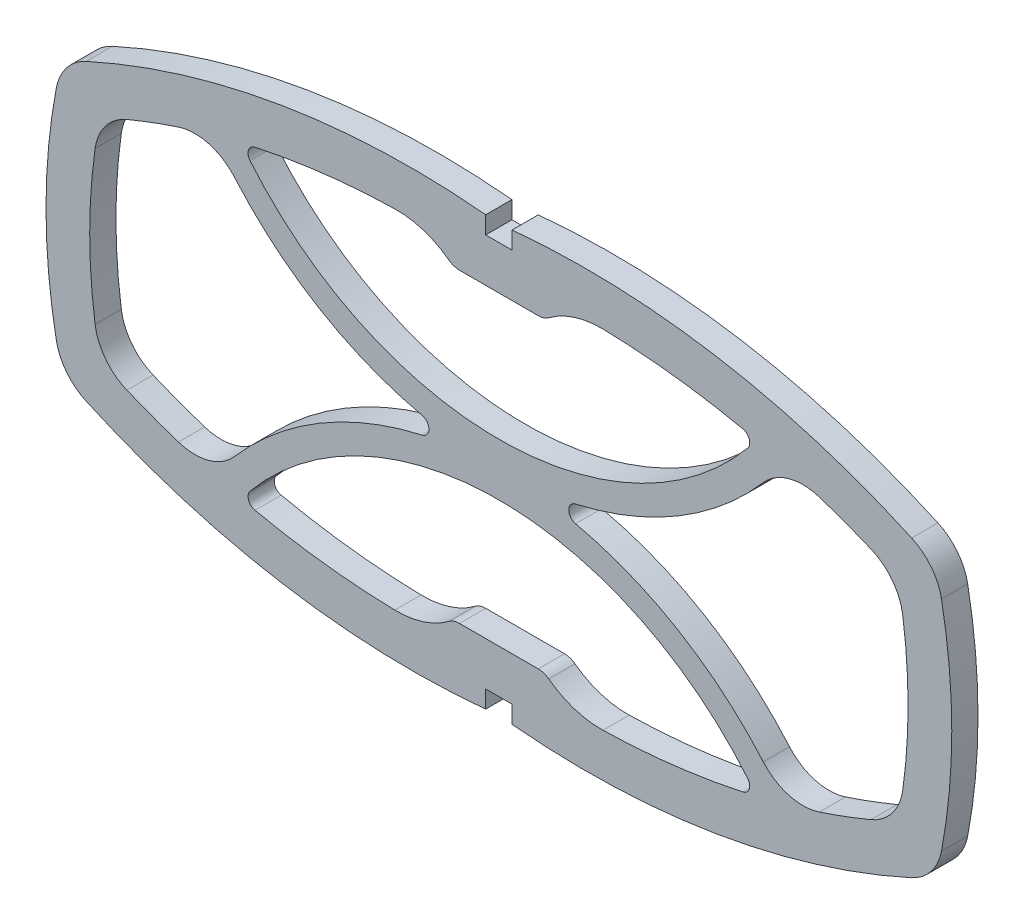
from build123d import *

# Parameters (mm, degrees)
BOSS_EXTRUDE1_DEPTH = 3
CUT_EXTRUDE1_REACH  = 69.03
SKETCH2_W           = 5
SKETCH2_H           = 35
BOSS_EXTRUDE8_DEPTH = 3
MIRROR1_DEPTH       = 3
FILLET1_R           = 2
FILLET2_R           = 10
FILLET3_R           = 6
FILLET4_R           = 1


# Read off the part's stored shape, not the designer's step: Mirror1
with BuildPart() as part:
    # Sketch1 → Boss-Extrude1 (new body)
    with BuildSketch(Plane.XY):
        with BuildLine():
            Line((-1.51, 0), (0, 0))
            Line((0, 0), (0, 5))
            Line((0, 5), (-1.51, 5))
            Line((-1.51, 5), (-1.51, 7))
            ThreePointArc((-1.51, 7), (-26.381774629, 5.897879108), (-50, -1.976082663))
            ThreePointArc((-50, -1.976082663), (-51.828078002, -17.5), (-50, -33.023917337))
            ThreePointArc((-50, -33.023917337), (-26.381774629, -40.897879108), (-1.51, -42))
            Line((-1.51, -42), (-1.51, -40))
            Line((-1.51, -40), (0, -40))
            Line((0, -40), (0, -35))
            Line((0, -35), (-1.51, -35))
            Line((-1.51, -35), (-1.51, -33))
            Line((-1.51, -33), (-1.51, -2))
            Line((-1.51, -2), (-1.51, 0))
        make_face()
    extrude(amount=BOSS_EXTRUDE1_DEPTH)

    # Sketch2 → Cut-Extrude1 (cut, up to next)
    with BuildSketch(Plane.XY.offset(3), mode=Mode.PRIVATE) as cut_extrude1_sk1:
        with BuildLine():
            ThreePointArc((-45.638636542, -5.430742036), (-46.828078002, -17.5), (-45.638636542, -29.569257964))
            ThreePointArc((-45.638636542, -29.569257964), (-26.536011476, -35.777357536), (-6.51, -37.329661985))
            Line((-6.51, -37.329661985), (-6.51, 2.329661985))
            ThreePointArc((-6.51, 2.329661985), (-26.536011476, 0.777357536), (-45.638636542, -5.430742036))
        make_face()
    cut_extrude1_tool1 = extrude(cut_extrude1_sk1.sketch, amount=-CUT_EXTRUDE1_REACH, mode=Mode.PRIVATE) & part.part
    # Sketch2 → Cut-Extrude1 (cut, up to next)
    with BuildSketch(Plane.XY.offset(3), mode=Mode.PRIVATE) as cut_extrude1_sk2:
        with Locations((-4.01, -17.5)):
            Rectangle(SKETCH2_W, SKETCH2_H)
    cut_extrude1_tool2 = extrude(cut_extrude1_sk2.sketch, amount=-CUT_EXTRUDE1_REACH, mode=Mode.PRIVATE) & part.part
    add(cut_extrude1_tool1.solids().sort_by_distance((-24.946194, -17.5, 3))[0], mode=Mode.SUBTRACT)
    add(cut_extrude1_tool2.solids().sort_by_distance((-4.01, -17.5, 3))[0], mode=Mode.SUBTRACT)

    # Sketch3 → Boss-Extrude8 (add)
    with BuildSketch(Plane.XY.offset(3)):
        with BuildLine():
            ThreePointArc((-32.612027687, -34.338487741), (-31.049231117, -34.753813219), (-29.478816537, -35.139334187))
            ThreePointArc((-29.478816537, -35.139334187), (-16.456843028, -24.361316901), (0, -20.5))
            Line((0, -20.5), (0, -14.5))
            ThreePointArc((0, -14.5), (-16.456843028, -10.638683099), (-29.478816537, 0.139334187))
            ThreePointArc((-29.478816537, 0.139334187), (-31.049231117, -0.246186781), (-32.612027687, -0.661512259))
            ThreePointArc((-32.612027687, -0.661512259), (-22.163998061, -10.798005795), (-8.780487851, -16.524390234))
            ThreePointArc((-8.780487851, -16.524390234), (-8, -17.499999784), (-8.780487429, -18.475609671))
            ThreePointArc((-8.780487429, -18.475609671), (-22.163997881, -24.201994085), (-32.612027687, -34.338487741))
        make_face()
    extrude(amount=-BOSS_EXTRUDE8_DEPTH)

    # Mirror1 outline → Mirror1 (add)
    with BuildSketch(Plane.XY):
        with BuildLine():
            ThreePointArc((29.478816537, -35.139334187), (18.069073524, -37.017473377), (6.51, -37.329661985))
            Line((6.51, -37.329661985), (6.51, -35))
            Line((6.51, -35), (0, -35))
            Line((0, -35), (0, -40))
            Line((0, -40), (1.51, -40))
            Line((1.51, -40), (1.51, -42))
            ThreePointArc((1.51, -42), (26.381774629, -40.897879108), (50, -33.023917337))
            ThreePointArc((50, -33.023917337), (51.828078002, -17.5), (50, -1.976082663))
            ThreePointArc((50, -1.976082663), (26.381774629, 5.897879108), (1.51, 7))
            Line((1.51, 7), (1.51, 5))
            Line((1.51, 5), (0, 5))
            Line((0, 5), (0, 0))
            Line((0, 0), (6.51, 0))
            Line((6.51, 0), (6.51, 2.329661985))
            ThreePointArc((6.51, 2.329661985), (18.069073524, 2.017473377), (29.478816537, 0.139334187))
            ThreePointArc((29.478816537, 0.139334187), (16.456843029, -10.638683099), (0, -14.5))
            Line((0, -14.5), (0, -20.5))
            ThreePointArc((0, -20.5), (16.456843029, -24.361316901), (29.478816537, -35.139334187))
        make_face()
        with BuildLine():
            ThreePointArc((45.638636542, -29.569257964), (39.22278835, -32.220063478), (32.612027687, -34.338487741))
            ThreePointArc((32.612027687, -34.338487741), (22.163998041, -24.201994192), (8.780487805, -18.475609756))
            ThreePointArc((8.780487805, -18.475609756), (8, -17.5), (8.780487805, -16.524390244))
            ThreePointArc((8.780487805, -16.524390244), (22.163998041, -10.798005808), (32.612027687, -0.661512259))
            ThreePointArc((32.612027687, -0.661512259), (39.22278835, -2.779936522), (45.638636542, -5.430742036))
            ThreePointArc((45.638636542, -5.430742036), (46.828078002, -17.5), (45.638636542, -29.569257964))
        make_face(mode=Mode.SUBTRACT)
    extrude(amount=MIRROR1_DEPTH)

    # Fillet1
    fillet1_edges = [part.edges().sort_by_distance(p)[0] for p in [
        (6.51, -35, 1.5),
        (6.51, 0, 1.5),
        (-6.51, 0, 1.5),
        (-6.51, -35, 1.5),
    ]]
    fillet(fillet1_edges, radius=FILLET1_R)

    # Fillet2
    fillet2_edges = [part.edges().sort_by_distance(p)[0] for p in [
        (-6.51, 2.329661985, 1.5),
        (6.51, 2.329661985, 1.5),
        (6.51, -37.329661985, 1.5),
        (-6.51, -37.329661985, 1.5),
    ]]
    fillet(fillet2_edges, radius=FILLET2_R)

    # Fillet3
    fillet3_edges = [part.edges().sort_by_distance(p)[0] for p in [
        (45.638636542, -5.430742036, 1.5),
        (45.638636542, -29.569257964, 1.5),
        (32.612027687, -0.661512259, 1.5),
        (32.612027687, -34.338487741, 1.5),
        (-50, -33.023917337, 1.5),
        (-50, -1.976082663, 1.5),
        (-45.638636542, -29.569257964, 1.5),
        (-45.638636542, -5.430742036, 1.5),
        (-32.612027687, -0.661512259, 1.5),
        (-32.612027687, -34.338487741, 1.5),
        (50, -1.976082663, 1.5),
        (50, -33.023917337, 1.5),
    ]]
    fillet(fillet3_edges, radius=FILLET3_R)

    # Fillet4
    fillet4_edges = [part.edges().sort_by_distance(p)[0] for p in [
        (29.478816537, 0.139334187, 1.5),
        (29.478816537, -35.139334187, 1.5),
        (-29.478816537, -35.139334187, 1.5),
        (-29.478816537, 0.139334187, 1.5),
    ]]
    fillet(fillet4_edges, radius=FILLET4_R)


solid = part.part
